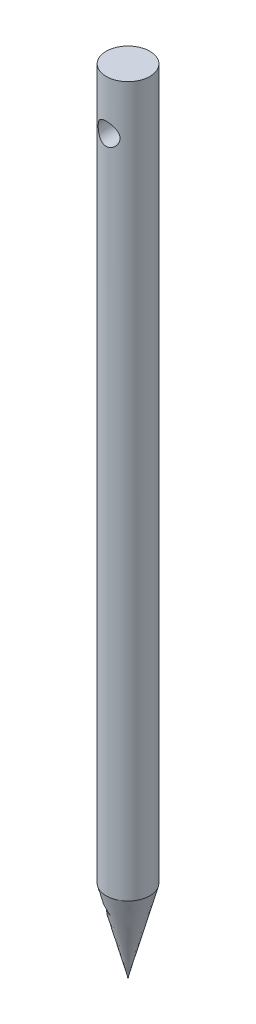
from build123d import *

# Parameters (mm, degrees)
SKETCH1_R           = 4
BOSS_EXTRUDE1_DEPTH = 129.988767867
SKETCH3_R           = 2
CUT_EXTRUDE1_DEPTH  = 19.5


with BuildPart() as part:
    # Sketch1 → Boss-Extrude1 (new body)
    with BuildSketch(Plane(origin=(0, 0, 0), x_dir=(1, 0, 0), z_dir=(0, 1, 0))):
        with Locations(Location((0, 0, 0), (0, 0, 270))):
            Circle(SKETCH1_R)
    extrude(amount=BOSS_EXTRUDE1_DEPTH)

    # Loft1: read off the stored shape, not the designer's step
    # Loft1: loft between two sections, ruled curve by curve
    loft1_from = [
        Edge.make_bspline([(0, -15, -0.05), (-0.1, -15, -0.05), (-0.1, -15, 0.05), (0, -15, 0.05), (0.1, -15, 0.05), (0.1, -15, -0.05), (0, -15, -0.05)], [0, 0, 0, 0, 0.5, 0.5, 0.5, 1, 1, 1, 1], 3, [1, 0.333333333, 0.333333333, 1, 0.333333333, 0.333333333, 1]),
    ]
    loft1_to = [
        Edge.make_bspline([(3.965560399, 0, 0.523765905), (5.013092209, 0, -7.407354893), (-2.918028589, 0, -8.454886703), (-3.965560399, 0, -0.523765905), (-5.013092209, 0, 7.407354893), (2.918028589, 0, 8.454886703), (3.965560399, 0, 0.523765905)], [0, 0, 0, 0, 0.5, 0.5, 0.5, 1, 1, 1, 1], 3, [1, 0.333333333, 0.333333333, 1, 0.333333333, 0.333333333, 1]),
    ]
    loft1 = Solid(Shell([*[Face.make_surface_from_curves(loft1_from[k], loft1_to[k]) for k in range(1)], Face(Wire(loft1_from)), Face(Wire(loft1_to))]))
    add(loft1)

    # Sketch3 → Cut-Extrude1 (cut, symmetric)
    with BuildSketch(Plane.XY):
        with Locations((0, 120.894404614)):
            Circle(SKETCH3_R)
    extrude(amount=CUT_EXTRUDE1_DEPTH, both=True, mode=Mode.SUBTRACT)


solid = part.part
